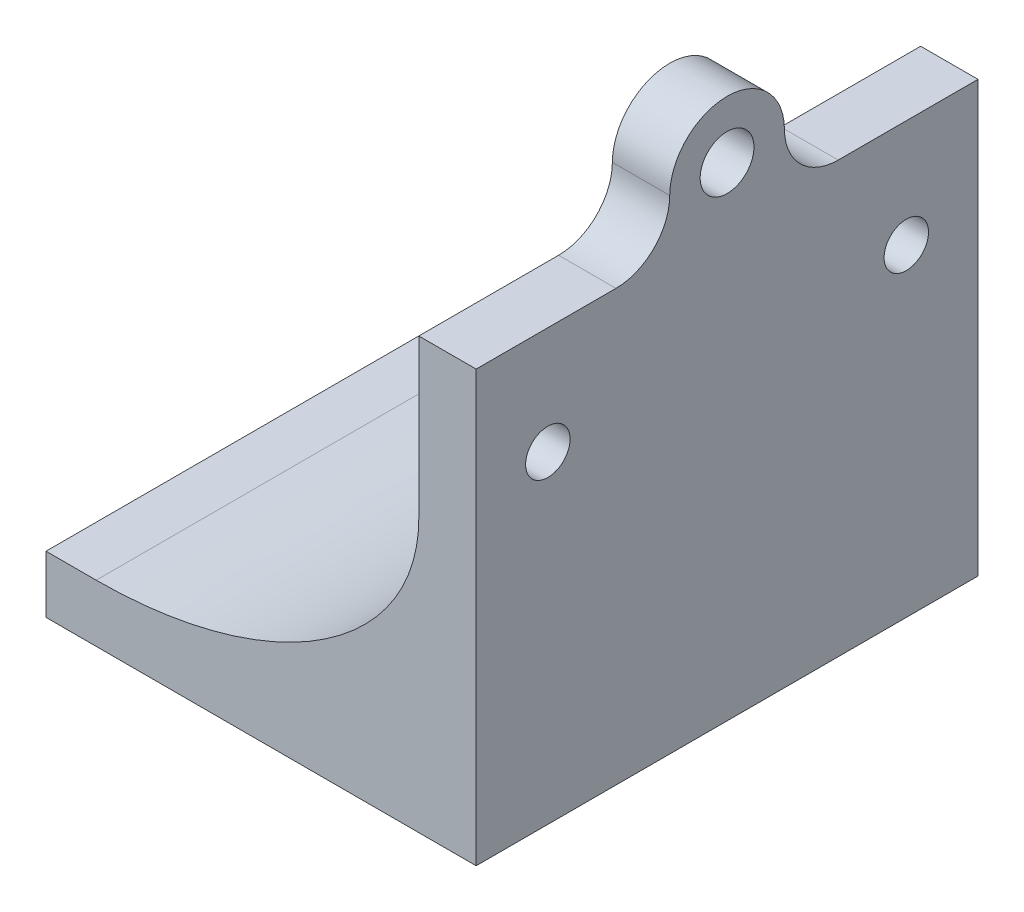
from build123d import *

# Parameters (mm, degrees)
RESSALTO_EXTRUS_O1_DEPTH = 70
CORTE_EXTRUS_O1_REACH    = 112
ESBO_O2_R                = 3.1
FILETE1_SIZE             = 30
FILETE1_SIZE_2           = 45
ESBO_O3_R                = 3.75
RESSALTO_EXTRUS_O2_DEPTH = 8


with BuildPart() as part:
    # Esboço1 → Ressalto-extrusão1 (new body)
    with BuildSketch(Plane.XY):
        Polygon((0, 0), (0, 60), (-8, 60), (-8, 8), (-60, 8), (-60, 0), align=None)
    extrude(amount=RESSALTO_EXTRUS_O1_DEPTH)

    # Esboço2 → Corte-extrusão1 (cut, up to next)
    with BuildSketch(Plane(origin=(0, 0, 0), x_dir=(0, 0, -1), z_dir=(1, 0, 0)), mode=Mode.PRIVATE) as corte_extrus_o1_sk1:
        with Locations((-60, 45)):
            Circle(ESBO_O2_R)
    corte_extrus_o1_tool1 = extrude(corte_extrus_o1_sk1.sketch, amount=-CORTE_EXTRUS_O1_REACH, mode=Mode.PRIVATE) & part.part
    # Esboço2 → Corte-extrusão1 (cut, up to next)
    with BuildSketch(Plane(origin=(0, 0, 0), x_dir=(0, 0, -1), z_dir=(1, 0, 0)), mode=Mode.PRIVATE) as corte_extrus_o1_sk2:
        with Locations((-10, 45)):
            Circle(ESBO_O2_R)
    corte_extrus_o1_tool2 = extrude(corte_extrus_o1_sk2.sketch, amount=-CORTE_EXTRUS_O1_REACH, mode=Mode.PRIVATE) & part.part
    add(corte_extrus_o1_tool1.solids().sort_by_distance((0, 45, 60))[0], mode=Mode.SUBTRACT)
    add(corte_extrus_o1_tool2.solids().sort_by_distance((0, 45, 10))[0], mode=Mode.SUBTRACT)

    # Filete1
    # an asymmetric fillet: 45, 30 mm, written as the material it adds along each edge
    with BuildSketch(Plane(origin=(-8, 8, 0), x_dir=(0, 1, 0), z_dir=(0, 0, 1))) as filete1_piece_1:
        with BuildLine():
            Bezier((FILETE1_SIZE, 0), (0, 0), (0, FILETE1_SIZE_2), weights=[1, 0.707106781, 1])
            Line((0, FILETE1_SIZE_2), (0, 0))
            Line((0, 0), (FILETE1_SIZE, 0))
        make_face()
    extrude(amount=70)

    # Esboço3 → Ressalto-extrusão2 (add)
    with BuildSketch(Plane(origin=(0, 0, 0), x_dir=(0, 0, -1), z_dir=(1, 0, 0))):
        with BuildLine():
            Line((-50.499916272, 60), (-19.500083728, 60))
            ThreePointArc((-19.500083728, 60), (-24.794661769, 62.187990647), (-27.000043214, 67.475348435))
            ThreePointArc((-27.000043214, 67.475348435), (-35, 75.449053432), (-42.999956786, 67.475348435))
            ThreePointArc((-42.999956786, 67.475348435), (-45.205338231, 62.187990647), (-50.499916272, 60))
        make_face()
        with Locations((-35, 67.449053432)):
            Circle(ESBO_O3_R, mode=Mode.SUBTRACT)
    extrude(amount=-RESSALTO_EXTRUS_O2_DEPTH)


solid = part.part
